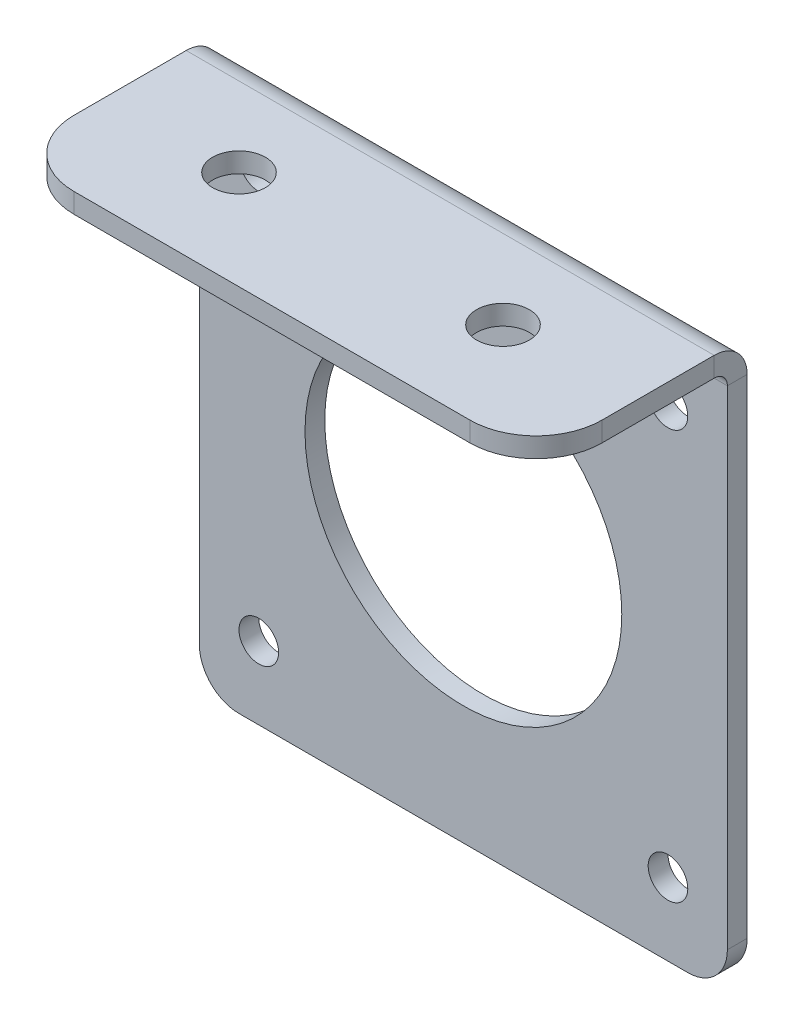
from build123d import *

# Parameters (mm, degrees)
SKETCH_1_R                       = 1.5
SKETCH_1_R_2                     = 12
SM_BASE_FLANGE_1_DEPTH           = 1.5
SM_EDGE_FLANGE_1_STRIP_W         = 8
SM_EDGE_FLANGE_1_STRIP_H         = 1.5
SM_EDGE_FLANGE_1_STRIP_CUT_DEPTH = 40
SM_EDGE_FLANGE_1_DEPTH           = 40
SM_EDGE_FLANGE_1_PROFILE_R       = 2
SM_EDGE_FLANGE_1_FLAT_DEPTH      = 1.5


# Sheet-metal steps are written as plain solids
with BuildPart() as part:
    # Sketch 1 → 基体-法兰1 (new body)
    with BuildSketch(Plane.XY):
        with BuildLine():
            Line((-20, 21.5), (20, 21.5))
            Line((20, 21.5), (20, -18))
            ThreePointArc((20, -18), (19.121320344, -20.121320344), (17, -21))
            Line((17, -21), (-17, -21))
            ThreePointArc((-17, -21), (-19.121320344, -20.121320344), (-20, -18))
            Line((-20, -18), (-20, 21.5))
        make_face()
        with Locations((-15.5, 15.5)):
            Circle(SKETCH_1_R, mode=Mode.SUBTRACT)
        with Locations(Location((15.5, 15.5, 0), (0, 0, 180))):
            Circle(SKETCH_1_R, mode=Mode.SUBTRACT)
        with Locations((15.5, -15.5)):
            Circle(SKETCH_1_R, mode=Mode.SUBTRACT)
        with Locations(Location((-15.5, -15.5, 0), (0, 0, 180))):
            Circle(SKETCH_1_R, mode=Mode.SUBTRACT)
        Circle(SKETCH_1_R_2, mode=Mode.SUBTRACT)
    extrude(amount=-SM_BASE_FLANGE_1_DEPTH)

    # 边线-法兰1 strip (across the edge) → 边线-法兰1 strip cut (cut)
    with BuildSketch(Plane(origin=(20, 21.5, 0), x_dir=(0, -1, 0), z_dir=(-1, 0, 0))):
        with Locations((-1.5, -0.75)):
            Rectangle(SM_EDGE_FLANGE_1_STRIP_W, SM_EDGE_FLANGE_1_STRIP_H)
    extrude(amount=SM_EDGE_FLANGE_1_STRIP_CUT_DEPTH, mode=Mode.SUBTRACT)

    # 边线-法兰1 bend section (across the edge) → 边线-法兰1 (add)
    with BuildSketch(Plane(origin=(20, 21.5, 0), x_dir=(0, -1, 0), z_dir=(-1, 0, 0))):
        with BuildLine():
            Line((0, 1), (1.5, 1))
            ThreePointArc((1.5, 1), (1.792893219, 0.292893219), (2.5, 0))
            Line((2.5, 0), (2.5, -1.5))
            ThreePointArc((2.5, -1.5), (0.732233047, -0.767766953), (0, 1))
        make_face()
    extrude(amount=SM_EDGE_FLANGE_1_DEPTH)

    # 边线-法兰1 profile (on flange) → 边线-法兰1 flat (add)
    with BuildSketch(Plane(origin=(0, 21.5, 0), x_dir=(-1, 0, 0), z_dir=(0, 1, 0))):
        with BuildLine():
            Line((15, 14.5), (-15, 14.5))
            ThreePointArc((-15, 14.5), (-18.535533906, 13.035533906), (-20, 9.5))
            Line((-20, 9.5), (-20, 1))
            Line((-20, 1), (20, 1))
            Line((20, 1), (20, 9.5))
            ThreePointArc((20, 9.5), (18.535533906, 13.035533906), (15, 14.5))
        make_face()
        with Locations((-10, 7)):
            Circle(SM_EDGE_FLANGE_1_PROFILE_R, mode=Mode.SUBTRACT)
        with Locations((10, 7)):
            Circle(SM_EDGE_FLANGE_1_PROFILE_R, mode=Mode.SUBTRACT)
    extrude(amount=-SM_EDGE_FLANGE_1_FLAT_DEPTH)


solid = part.part
